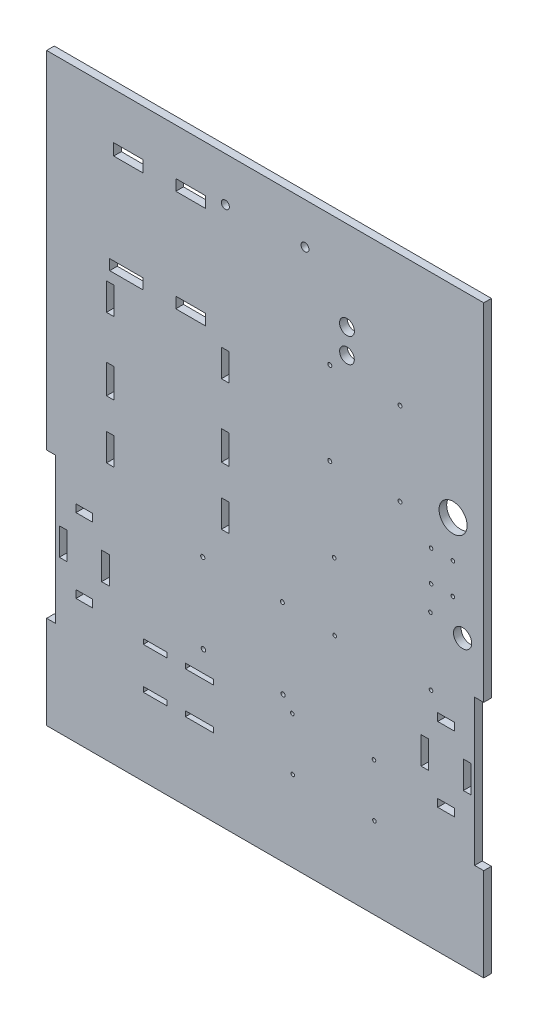
from build123d import *

# Parameters (mm, degrees)
SKETCH1_W                = 304.8
SKETCH1_H                = 304.8
BOSS_EXTRUDE1_DEPTH      = 5.334
SKETCH2_W                = 6.35
SKETCH2_H                = 101.6
CUT_EXTRUDE1_DEPTH       = 216.592141684
SKETCH26_W               = 11.599333334
SKETCH26_H               = 5.334
SKETCH26_W_2             = 5.334
SKETCH26_H_2             = 19.05
CUT_EXTRUDE11_DEPTH      = 216.592141684
SKETCH27_W               = 11.599333334
SKETCH27_H               = 5.334
SKETCH27_W_2             = 5.334
SKETCH27_H_2             = 19.05
CUT_EXTRUDE12_DEPTH      = 216.592141684
SKETCH29_W               = 304.8
SKETCH29_H               = 24.084758951
CUT_EXTRUDE13_DEPTH      = 216.592141684
SKETCH31_R               = 1.374999997
CUT_EXTRUDE15_DEPTH      = 216.592141684
SKETCH32_R               = 1.25
CUT_EXTRUDE16_DEPTH      = 216.592141684
SKETCH34_R               = 1.249249948
SKETCH34_R_2             = 1.249999989
SKETCH34_R_3             = 1.252496269
SKETCH34_R_4             = 1.251959014
CUT_EXTRUDE18_DEPTH      = 216.592141684
SKETCH40_W               = 304.8
SKETCH40_H               = 5.334
BOSS_EXTRUDE2_DEPTH      = 76.2
SKETCH41_R               = 2.778125
CUT_EXTRUDE24_DEPTH      = 275.794780802
CUT_EXTRUDE25_DEPTH      = 275.794780802
CUT_EXTRUDE25_DEPTH_BACK = 275.794780802
SKETCH42_R               = 1.246523933
SKETCH42_R_2             = 1.251934436
SKETCH42_R_3             = 1.248703554
SKETCH42_R_4             = 1.245581387
SKETCH44_W               = 16.476980096
SKETCH44_H               = 3.5
SKETCH44_W_2             = 19.633145944
SKETCH44_H_2             = 3.596708667
CUT_EXTRUDE27_DEPTH      = 275.794780802
SKETCH45_W               = 20.354162164
SKETCH45_H               = 8.066046326
SKETCH45_W_2             = 20.554982424
SKETCH45_H_2             = 7.688212903
SKETCH45_H_3             = 7.652166289
SKETCH45_W_3             = 23.136298987
SKETCH45_H_4             = 7.272580335
CUT_EXTRUDE28_DEPTH      = 275.794780802
SKETCH46_W               = 304.8
SKETCH46_H               = 5.334
BOSS_EXTRUDE3_DEPTH      = 50.8
SKETCH47_R               = 9.778477959
SKETCH47_R_2             = 6.35205685
CUT_EXTRUDE29_DEPTH      = 275.794780802
SKETCH49_W               = 5.334
SKETCH49_H               = 19.05
SKETCH49_H_2             = 20.295839927
CUT_EXTRUDE30_DEPTH      = 275.794780802
SKETCH52_R               = 5.113702669
SKETCH52_R_2             = 5.177907844
CUT_EXTRUDE33_DEPTH      = 275.794780802
SKETCH53_R               = 1.453182324
SKETCH53_R_2             = 1.544206751
SKETCH53_R_3             = 1.384511213
SKETCH53_R_4             = 1.455425475
CUT_EXTRUDE34_DEPTH      = 275.794780802


with BuildPart() as part:
    # Sketch1 → Boss-Extrude1 (new body)
    with BuildSketch(Plane.XY):
        Rectangle(SKETCH1_W, SKETCH1_H)
    extrude(amount=BOSS_EXTRUDE1_DEPTH)

    # Sketch2 → Cut-Extrude1 (cut, through all)
    with BuildSketch(Plane(origin=(0, 0, 0), x_dir=(-1, 0, 0), z_dir=(0, 0, -1))):
        with Locations((149.225, -63.5)):
            Rectangle(SKETCH2_W, SKETCH2_H)
        with Locations((-149.225, -63.5)):
            Rectangle(SKETCH2_W, SKETCH2_H)
    extrude(amount=-CUT_EXTRUDE1_DEPTH, mode=Mode.SUBTRACT)

    # Sketch26 → Cut-Extrude11 (cut, through all)
    with BuildSketch(Plane.XY.offset(5.334)):
        with Locations((-126.111, -89.408)):
            Rectangle(SKETCH26_W, SKETCH26_H)
        with Locations((-111.379, -63.5)):
            Rectangle(SKETCH26_W_2, SKETCH26_H_2)
        with Locations((-126.111, -37.592)):
            Rectangle(SKETCH26_W, SKETCH26_H)
        with Locations((-140.843, -63.5)):
            Rectangle(SKETCH26_W_2, SKETCH26_H_2)
    extrude(amount=-CUT_EXTRUDE11_DEPTH, mode=Mode.SUBTRACT)

    # Sketch27 → Cut-Extrude12 (cut, through all)
    with BuildSketch(Plane.XY.offset(5.334)):
        with Locations((126.111, -89.408)):
            Rectangle(SKETCH27_W, SKETCH27_H)
        with Locations((111.379, -63.5)):
            Rectangle(SKETCH27_W_2, SKETCH27_H_2)
        with Locations((126.111, -37.592)):
            Rectangle(SKETCH27_W, SKETCH27_H)
        with Locations((140.843, -63.5)):
            Rectangle(SKETCH27_W_2, SKETCH27_H_2)
    extrude(amount=-CUT_EXTRUDE12_DEPTH, mode=Mode.SUBTRACT)

    # Sketch29 → Cut-Extrude13 (cut, through all)
    with BuildSketch(Plane(origin=(0, 0, 0), x_dir=(-1, 0, 0), z_dir=(0, 0, -1))):
        with Locations((0, -140.357620525)):
            Rectangle(SKETCH29_W, SKETCH29_H)
    extrude(amount=-CUT_EXTRUDE13_DEPTH, mode=Mode.SUBTRACT)

    # Sketch31 → Cut-Extrude15 (cut, through all)
    with BuildSketch(Plane(origin=(0, 0, 0), x_dir=(-1, 0, 0), z_dir=(0, 0, -1))):
        with Locations((-45.059570206, 79.420619723)):
            Circle(SKETCH31_R)
        with Locations((-94.059570206, 79.420619723)):
            Circle(SKETCH31_R)
        with Locations((-45.059570206, 137.420619723)):
            Circle(SKETCH31_R)
        with Locations((-94.059570206, 137.420619723)):
            Circle(SKETCH31_R)
    extrude(amount=-CUT_EXTRUDE15_DEPTH, mode=Mode.SUBTRACT)

    # Sketch32 → Cut-Extrude16 (cut, through all)
    with BuildSketch(Plane(origin=(0, 0, 0), x_dir=(-1, 0, 0), z_dir=(0, 0, -1))):
        with Locations((-115.659362359, 62.121837807)):
            Circle(SKETCH32_R)
        with Locations((-130.899362359, 62.121837807)):
            Circle(SKETCH32_R)
        with Locations((-130.899362359, 40.531837807)):
            Circle(SKETCH32_R)
        with Locations((-115.659362359, 40.531837807)):
            Circle(SKETCH32_R)
    extrude(amount=-CUT_EXTRUDE16_DEPTH, mode=Mode.SUBTRACT)

    # Sketch34 → Cut-Extrude18 (cut, through all)
    with BuildSketch(Plane(origin=(0, 0, 0), x_dir=(-1, 0, 0), z_dir=(0, 0, -1))):
        with Locations((-75.859031621, -85.661481104)):
            Circle(SKETCH34_R)
        with Locations((-76.178771882, -122.300085965)):
            Circle(SKETCH34_R_2)
        with Locations((-19.22065278, -122.79715194)):
            Circle(SKETCH34_R_3)
        with Locations((-18.900912519, -86.158547079)):
            Circle(SKETCH34_R_4)
    extrude(amount=-CUT_EXTRUDE18_DEPTH, mode=Mode.SUBTRACT)

    # Sketch40 → Boss-Extrude2 (add)
    with BuildSketch(Plane(origin=(0, 152.4, 0), x_dir=(1, 0, 0), z_dir=(0, 1, 0))):
        with Locations((0, -2.667)):
            Rectangle(SKETCH40_W, SKETCH40_H)
    extrude(amount=BOSS_EXTRUDE2_DEPTH)

    # Sketch41 → Cut-Extrude24 (cut, through all)
    with BuildSketch(Plane(origin=(0, 0, 0), x_dir=(-1, 0, 0), z_dir=(0, 0, -1))):
        with Locations((-27.760706508, 199.901266022)):
            Circle(SKETCH41_R)
        with Locations((27.760706508, 197.764889883)):
            Circle(SKETCH41_R)
    extrude(amount=-CUT_EXTRUDE24_DEPTH, mode=Mode.SUBTRACT)

    # Sketch42 → Cut-Extrude25 (cut, two sides: drawn at the far end of the back side and taken through both)
    with BuildSketch(Plane(origin=(0, 0, 0), x_dir=(-1, 0, 0), z_dir=(0, 0, -1)).offset(-CUT_EXTRUDE25_DEPTH_BACK)):
        with Locations((-115.211077047, 23.129350218)):
            Circle(SKETCH42_R)
        with Locations((-48.093632771, 22.543625155)):
            Circle(SKETCH42_R_2)
        with Locations((-48.502034632, -24.254592845)):
            Circle(SKETCH42_R_3)
        with Locations((-115.619478908, -23.668867782)):
            Circle(SKETCH42_R_4)
    extrude(amount=CUT_EXTRUDE25_DEPTH + CUT_EXTRUDE25_DEPTH_BACK, mode=Mode.SUBTRACT)

    # Sketch44 → Cut-Extrude27 (cut, through all)
    with BuildSketch(Plane(origin=(0, 0, 0), x_dir=(-1, 0, 0), z_dir=(0, 0, -1))):
        with Locations((76.712846496, -123.491430997)):
            Rectangle(SKETCH44_W, SKETCH44_H)
        with Locations((76.712846496, -94.591430997)):
            Rectangle(SKETCH44_W, SKETCH44_H)
        with Locations((45.782293013, -123.539785331)):
            Rectangle(SKETCH44_W_2, SKETCH44_H_2)
        with Locations((45.782293013, -94.688139664)):
            Rectangle(SKETCH44_W_2, SKETCH44_H)
    extrude(amount=-CUT_EXTRUDE27_DEPTH, mode=Mode.SUBTRACT)

    # Sketch45 → Cut-Extrude28 (cut, through all)
    with BuildSketch(Plane(origin=(0, 0, 0), x_dir=(-1, 0, 0), z_dir=(0, 0, -1))):
        with Locations((95.443302682, 192.238942396)):
            Rectangle(SKETCH45_W, SKETCH45_H)
        with Locations((52.047470718, 192.427859108)):
            Rectangle(SKETCH45_W_2, SKETCH45_H_2)
        with Locations((52.047470716, 121.434632148)):
            Rectangle(SKETCH45_W_2, SKETCH45_H_3)
        with Locations((96.834371094, 121.244839171)):
            Rectangle(SKETCH45_W_3, SKETCH45_H_4)
    extrude(amount=-CUT_EXTRUDE28_DEPTH, mode=Mode.SUBTRACT)

    # Sketch46 → Boss-Extrude3 (add)
    with BuildSketch(Plane.XZ.offset(128.315241049)):
        with Locations((0, 2.667)):
            Rectangle(SKETCH46_W, SKETCH46_H)
    extrude(amount=BOSS_EXTRUDE3_DEPTH)

    # Sketch47 → Cut-Extrude29 (cut, through all)
    with BuildSketch(Plane(origin=(0, 0, 0), x_dir=(-1, 0, 0), z_dir=(0, 0, -1))):
        with Locations((-131.017495066, 88.21224972)):
            Circle(SKETCH47_R)
        with Locations((-137.650958824, 18.755982137)):
            Circle(SKETCH47_R_2)
    extrude(amount=-CUT_EXTRUDE29_DEPTH, mode=Mode.SUBTRACT)

    # Sketch49 → Cut-Extrude30 (cut, through all)
    with BuildSketch(Plane.XY.offset(5.334)):
        with Locations((-27.846255786, 9.907194543)):
            Rectangle(SKETCH49_W, SKETCH49_H)
        with Locations((-107.98240516, 9.907194543)):
            Rectangle(SKETCH49_W, SKETCH49_H)
        with Locations((-107.98240516, 51.068016377)):
            Rectangle(SKETCH49_W, SKETCH49_H_2)
        with Locations((-107.98240516, 100.839194543)):
            Rectangle(SKETCH49_W, SKETCH49_H)
        with Locations((-27.846255786, 100.839194543)):
            Rectangle(SKETCH49_W, SKETCH49_H)
        with Locations((-27.846255786, 51.068016377)):
            Rectangle(SKETCH49_W, SKETCH49_H_2)
    extrude(amount=-CUT_EXTRUDE30_DEPTH, mode=Mode.SUBTRACT)

    # Sketch52 → Cut-Extrude33 (cut, through all)
    with BuildSketch(Plane(origin=(0, 0, 0), x_dir=(-1, 0, 0), z_dir=(0, 0, -1))):
        with Locations((-57.021451744, 149.159143491)):
            Circle(SKETCH52_R)
        with Locations((-57.021451744, 166.299522531)):
            Circle(SKETCH52_R_2)
    extrude(amount=-CUT_EXTRUDE33_DEPTH, mode=Mode.SUBTRACT)

    # Sketch53 → Cut-Extrude34 (cut, through all)
    with BuildSketch(Plane.XY.offset(5.334)):
        with Locations((-43.524965301, -22.819488399)):
            Circle(SKETCH53_R)
        with Locations((-43.040642581, -78.317375129)):
            Circle(SKETCH53_R_2)
        with Locations((11.972921429, -22.335165679)):
            Circle(SKETCH53_R_3)
        with Locations((12.457244149, -77.833052409)):
            Circle(SKETCH53_R_4)
    extrude(amount=-CUT_EXTRUDE34_DEPTH, mode=Mode.SUBTRACT)


solid = part.part
